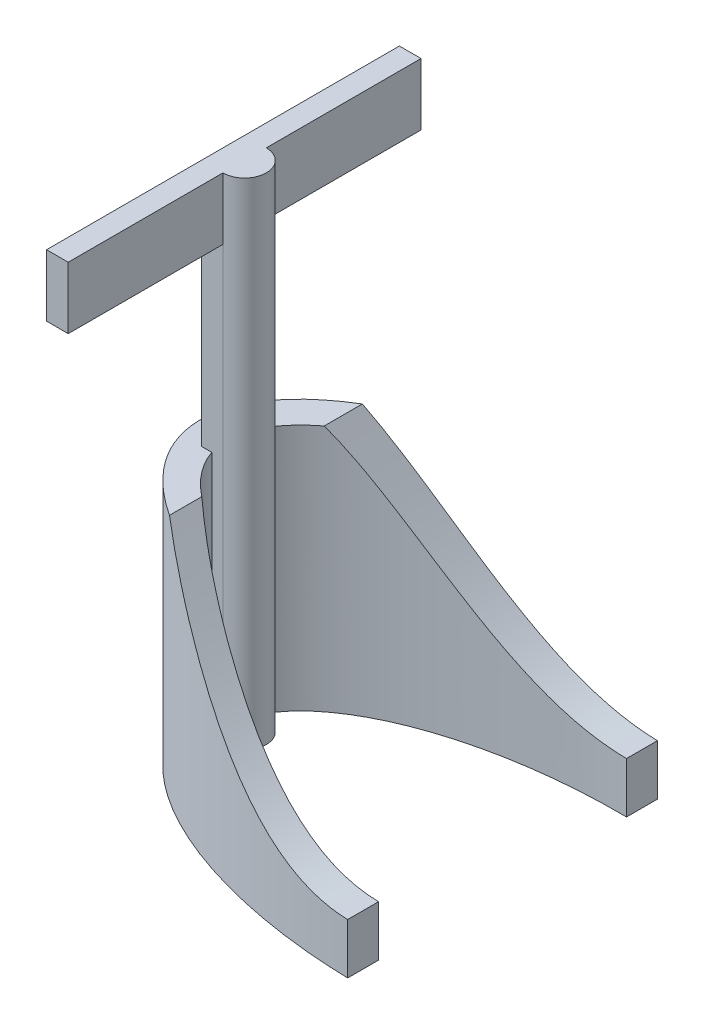
from build123d import *

# Parameters (mm, degrees)
SKETCH1_RX          = 50.023380752
SKETCH1_RY          = 25.011690376
BOSS_EXTRUDE1_DEPTH = 40
SKETCH2_W           = 53.048194423
SKETCH2_H           = 52.128277272
CUT_EXTRUDE1_DEPTH  = 40
SKETCH3_RX          = 45.004218106
SKETCH3_RY          = 20.025989305
CUT_EXTRUDE3_DEPTH  = 40
HANDLE_DEPTH        = 40
HANDLE_DEPTH_BACK   = 40
SKETCH4_W           = 7
SKETCH4_H           = 7
CUT_EXTRUDE4_START  = -27.500221438
CUT_EXTRUDE4_DEPTH  = 50.067195632
FILLET1_RADIUS      = 3.5
FILLET1_LENGTH      = 80
SKETCH6_W           = 3.5
SKETCH6_H           = 10
BOSS_EXTRUDE2_DEPTH = 25
SKETCH9_W           = 3.5
SKETCH9_H           = 10
BOSS_EXTRUDE3_DEPTH = 25


# Read off the part's stored shape, not the designer's step: Cut-Extrude4
with BuildPart() as part:
    # Sketch1 → Boss-Extrude1 (new body)
    with BuildSketch(Plane(origin=(0, 0, 0), x_dir=(1, 0, 0), z_dir=(0, 1, 0))):
        with Locations(Location((0, 0), (0, 0, -1.751851392))):
            Ellipse(SKETCH1_RX, SKETCH1_RY)
    extrude(amount=BOSS_EXTRUDE1_DEPTH)

    # Sketch2 → Cut-Extrude1 (cut)
    with BuildSketch(Plane(origin=(0, 40, 0), x_dir=(1, 0, 0), z_dir=(0, 1, 0))):
        with Locations((26.524365297, -1.043684065)):
            Rectangle(SKETCH2_W, SKETCH2_H)
    extrude(amount=-CUT_EXTRUDE1_DEPTH, mode=Mode.SUBTRACT)

    # Sketch3 → Cut-Extrude3 (cut)
    with BuildSketch(Plane(origin=(0, 40, 0), x_dir=(1, 0, 0), z_dir=(0, 1, 0))):
        with Locations(Location((0, 0), (0, 0, -0.784464251))):
            Ellipse(SKETCH3_RX, SKETCH3_RY)
    extrude(amount=-CUT_EXTRUDE3_DEPTH, mode=Mode.SUBTRACT)

    # Sketch4 → handle (add, two sides: drawn at the far end of the back side and taken through both)
    with BuildSketch(Plane(origin=(1.890919535, 40, 0), x_dir=(1, 0, 0), z_dir=(0, 1, 0)).offset(-HANDLE_DEPTH_BACK)):
        with Locations((-44.607863545, 1.046507327)):
            Rectangle(SKETCH4_W, SKETCH4_H)
    extrude(amount=HANDLE_DEPTH + HANDLE_DEPTH_BACK)

    # Cut-Extrude4 outline → Cut-Extrude4 (cut)
    with BuildSketch(Plane(origin=(1.890919535, 0, 2.453492673), x_dir=(1, 0, 0), z_dir=(0, 0, 1)).offset(CUT_EXTRUDE4_START)):
        with BuildLine():
            Line((-1.89065145, 40), (-41.022009989, 40))
            add(Edge.make_bspline(
                [(-41.022009989, 40), (-29.747385861, 24.075030507), (-18.472761733, 8.150061014), (-1.89065145, 8.183439673)],
                knots=[0, 0, 0, 0, 0.942635283, 0.942635283, 0.942635283, 0.942635283], degree=3))
            Line((-1.89065145, 8.183439673), (-1.89065145, 40))
        make_face()
    extrude(amount=CUT_EXTRUDE4_DEPTH, mode=Mode.SUBTRACT)

    # Fillet1: full round fillet: the end face becomes a half cylinder, R = half its width
    fillet1_face = Plane((-39.21694401, 40, -1.046507327), x_dir=(0, 1, 0), z_dir=(1, 0, 0))  # on the end face: x along it, z out of the body
    fillet1_slab = fillet1_face.offset(-FILLET1_RADIUS / 2) * Box(FILLET1_LENGTH, 2 * FILLET1_RADIUS, FILLET1_RADIUS, mode=Mode.PRIVATE)  # the body's end, R deep
    fillet1_round = Plane((-42.71694401, 40, -1.046507327), x_dir=(1, 0, 0), z_dir=(0, 1, 0)) * Cylinder(FILLET1_RADIUS, FILLET1_LENGTH, mode=Mode.PRIVATE)  # its axis R under the face
    add(fillet1_slab - fillet1_round, mode=Mode.SUBTRACT)

    # Sketch6 → Boss-Extrude2 (add)
    with BuildSketch(Plane.XY.offset(2.453492673)):
        with Locations((-44.46694401, 75)):
            Rectangle(SKETCH6_W, SKETCH6_H)
    extrude(amount=BOSS_EXTRUDE2_DEPTH)

    # Sketch9 → Boss-Extrude3 (add)
    with BuildSketch(Plane(origin=(0, 0, -4.546507327), x_dir=(-1, 0, 0), z_dir=(0, 0, -1))):
        with Locations((44.46694401, 75)):
            Rectangle(SKETCH9_W, SKETCH9_H)
    extrude(amount=BOSS_EXTRUDE3_DEPTH)


solid = part.part
